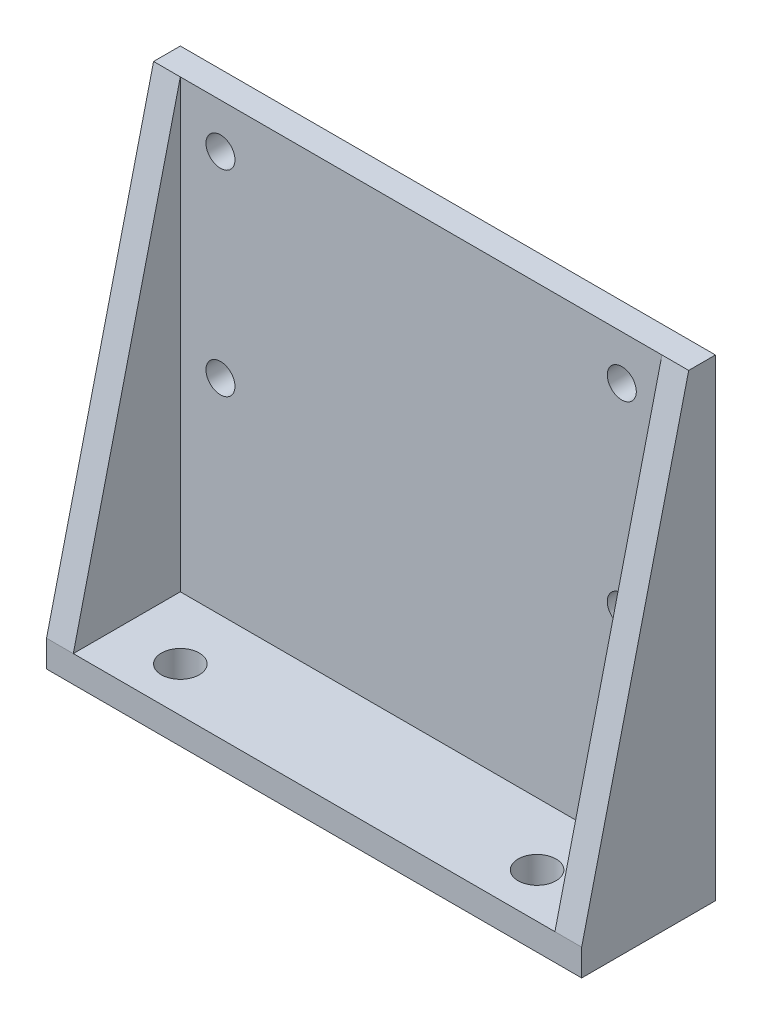
from build123d import *

# Parameters (mm, degrees)
SKETCH1_W           = 60
SKETCH1_H           = 15
SKETCH1_R           = 2.125
BOSS_EXTRUDE1_DEPTH = 3
SKETCH2_W           = 60
SKETCH2_H           = 50
SKETCH2_R           = 1.625
BOSS_EXTRUDE2_DEPTH = 3
BOSS_EXTRUDE3_DEPTH = 3


with BuildPart() as part:
    # Sketch1 → Boss-Extrude1 (new body)
    with BuildSketch(Plane(origin=(0, 0, 0), x_dir=(1, 0, 0), z_dir=(0, 1, 0))):
        with Locations((30, 7.5)):
            Rectangle(SKETCH1_W, SKETCH1_H)
        with Locations((10, 5)):
            Circle(SKETCH1_R, mode=Mode.SUBTRACT)
        with Locations((50, 5)):
            Circle(SKETCH1_R, mode=Mode.SUBTRACT)
    extrude(amount=BOSS_EXTRUDE1_DEPTH)

    # Sketch2 → Boss-Extrude2 (add)
    with BuildSketch(Plane(origin=(0, 0, -15), x_dir=(-1, 0, 0), z_dir=(0, 0, -1))):
        with Locations((-30, 28)):
            Rectangle(SKETCH2_W, SKETCH2_H)
        with Locations((-52.5, 48)):
            Circle(SKETCH2_R, mode=Mode.SUBTRACT)
        with Locations((-52.5, 26)):
            Circle(SKETCH2_R, mode=Mode.SUBTRACT)
        with Locations((-7.5, 26)):
            Circle(SKETCH2_R, mode=Mode.SUBTRACT)
        with Locations((-7.5, 48)):
            Circle(SKETCH2_R, mode=Mode.SUBTRACT)
    extrude(amount=-BOSS_EXTRUDE2_DEPTH)

    # Sketch3 → Boss-Extrude3 (add)
    with BuildSketch(Plane.ZY):
        Polygon((-12, 53), (0, 3), (-12, 3), align=None)
    boss_extrude3 = extrude(amount=-BOSS_EXTRUDE3_DEPTH)

    # Mirror1: Boss-Extrude3 across plane
    add(boss_extrude3.mirror(Plane.ZY.offset(-30)))


solid = part.part
